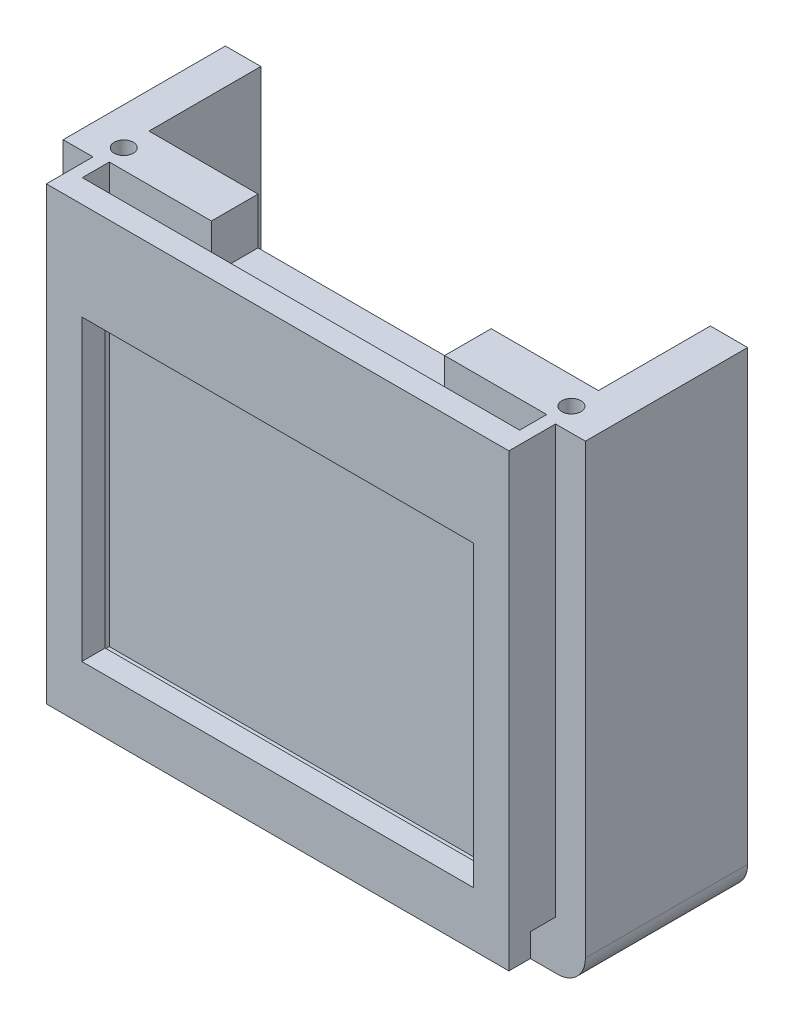
from build123d import *

# Parameters (mm, degrees)
BOSS_EXTRUDE1_OUTLINE_W      = 4.95
BOSS_EXTRUDE1_OUTLINE_H      = 2.9
BOSS_EXTRUDE1_DEPTH          = 51
BOSS_EXTRUDE1_2_OUTLINE_W    = 46.1
BOSS_EXTRUDE1_2_OUTLINE_H    = 2.9
BOSS_EXTRUDE1_2_DEPTH        = 6
SKETCH2_W                    = 56
SKETCH2_H                    = 51
SKETCH2_W_2                  = 42
SKETCH2_H_2                  = 32
BOSS_EXTRUDE2_DEPTH          = 2.5
BOSS_EXTRUDE3_DEPTH          = 5
M3X0_5_TAPPED_HOLE1_D        = 2.5
M3X0_5_TAPPED_HOLE1_DEPTH    = 4
M3X0_5_TAPPED_HOLE1_TIP      = 0.751075774
SKETCH9_W                    = 56
SKETCH9_H                    = 2.5
BOSS_EXTRUDE4_DEPTH          = 5
SKETCH9_3_W                  = 56
SKETCH9_3_H                  = 9.5
BOSS_EXTRUDE5_DEPTH          = 2.5
M2_5X0_45_TAPPED_HOLE1_D     = 2.05
M2_5X0_45_TAPPED_HOLE1_DEPTH = 6.35
M2_5X0_45_TAPPED_HOLE1_TIP   = 0.615882135
BOSS_EXTRUDE6_REACH          = 78.688
SKETCH12_W                   = 4
SKETCH12_H                   = 51
SKETCH13_W                   = 4
SKETCH13_H                   = 9
CUT_EXTRUDE1_DEPTH           = 2.5
SKETCH14_W                   = 12
SKETCH14_H                   = 30
CUT_EXTRUDE2_DEPTH           = 3
CUT_EXTRUDE3_DEPTH           = 78.62731478
SKETCH17_W                   = 5
SKETCH17_H                   = 51
CUT_EXTRUDE4_DEPTH           = 3
SKETCH18_W                   = 5
SKETCH18_H                   = 51
CUT_EXTRUDE5_DEPTH           = 3
FILLET1_R                    = 3
MOVE_FACE1_BY                = 0.2
MOVE_FACE1_2_BY              = 0.2
MOVE_FACE1_3_BY              = 0.2
MOVE_FACE1_4_BY              = 0.2
MOVE_FACE1_5_BY              = 0.2
MOVE_FACE1_6_BY              = 0.2
MOVE_FACE1_7_BY              = 0.2
MOVE_FACE1_8_BY              = 0.2
MOVE_FACE1_9_BY              = 0.2
MOVE_FACE1_10_BY             = 0.2
MOVE_START                   = 4.55
MOVE_FACE2_OUTLINE_W         = 45
MOVE_FACE2_OUTLINE_H         = 2.9
MOVE_FACE2_DEPTH             = 46.9


# Read off the part's stored shape, not the designer's step: Boss-Extrude1, Move Face2
with BuildPart() as part:
    # Boss-Extrude1 outline → Boss-Extrude1 (new body)
    with BuildSketch(Plane(origin=(0, 0, 0), x_dir=(1, 0, 0), z_dir=(0, 1, 0))):
        with Locations((2.475, -1.45)):
            Rectangle(BOSS_EXTRUDE1_OUTLINE_W, BOSS_EXTRUDE1_OUTLINE_H)
        with Locations((53.525, -1.45)):
            Rectangle(BOSS_EXTRUDE1_OUTLINE_W, BOSS_EXTRUDE1_OUTLINE_H)
    extrude(amount=BOSS_EXTRUDE1_DEPTH)

    # Boss-Extrude1 2 outline → Boss-Extrude1 2 (add)
    with BuildSketch(Plane(origin=(0, 0, 0), x_dir=(1, 0, 0), z_dir=(0, 1, 0))):
        with Locations((28, -1.45)):
            Rectangle(BOSS_EXTRUDE1_2_OUTLINE_W, BOSS_EXTRUDE1_2_OUTLINE_H)
    extrude(amount=BOSS_EXTRUDE1_2_DEPTH)

    # Sketch2 → Boss-Extrude2 (add)
    with BuildSketch(Plane.XY.offset(2.9)):
        with Locations((28, 25.5)):
            Rectangle(SKETCH2_W, SKETCH2_H)
        with Locations((28, 24.54)):
            Rectangle(SKETCH2_W_2, SKETCH2_H_2, mode=Mode.SUBTRACT)
    extrude(amount=BOSS_EXTRUDE2_DEPTH)

    # Sketch3 → Boss-Extrude3 (add)
    with BuildSketch(Plane(origin=(0, 0, 0), x_dir=(-1, 0, 0), z_dir=(0, 0, -1))):
        Polygon((-56, 51), (-40.5, 51), (-40.5, 46), (-15.5, 46), (-15.5, 51), (0, 51), (0, 0), (-56, 0), align=None)
    extrude(amount=BOSS_EXTRUDE3_DEPTH)

    # M3x0.5 Tapped Hole1
    with Locations(Plane(origin=(0, 0, -5), x_dir=(-1, 0, 0), z_dir=(0, 0, -1))):
        with Locations((-49.25, 37), (-6.75, 37), (-6.75, 10), (-49.25, 10)):
            Hole(M3X0_5_TAPPED_HOLE1_D / 2, depth=M3X0_5_TAPPED_HOLE1_DEPTH)
            with Locations((0, 0, -(M3X0_5_TAPPED_HOLE1_DEPTH + M3X0_5_TAPPED_HOLE1_TIP / 2))):  # 118° drill point
                Cone(0, M3X0_5_TAPPED_HOLE1_D / 2, M3X0_5_TAPPED_HOLE1_TIP, mode=Mode.SUBTRACT)



with BuildPart() as body_2:
    # Sketch9 → Boss-Extrude4 (new body)
    with BuildSketch(Plane.XZ):
        with Locations((28, -15.75)):
            Rectangle(SKETCH9_W, SKETCH9_H)
    extrude(amount=-BOSS_EXTRUDE4_DEPTH)


with BuildPart() as part_1:
    add(part.part)

    add(body_2.part)  # Boss-Extrude5 merges body 2
    # Sketch9<3> → Boss-Extrude5 (add)
    with BuildSketch(Plane.XZ):
        with Locations((28, -9.75)):
            Rectangle(SKETCH9_3_W, SKETCH9_3_H)
    extrude(amount=-BOSS_EXTRUDE5_DEPTH)

    # M2.5x0.45 Tapped Hole1
    with Locations(Plane(origin=(0, 51, 0), x_dir=(1, 0, 0), z_dir=(0, 1, 0))):
        with Locations((4, 2.1), (52, 2.1)):
            Hole(M2_5X0_45_TAPPED_HOLE1_D / 2, depth=M2_5X0_45_TAPPED_HOLE1_DEPTH)
            with Locations((0, 0, -(M2_5X0_45_TAPPED_HOLE1_DEPTH + M2_5X0_45_TAPPED_HOLE1_TIP / 2))):  # 118° drill point
                Cone(0, M2_5X0_45_TAPPED_HOLE1_D / 2, M2_5X0_45_TAPPED_HOLE1_TIP, mode=Mode.SUBTRACT)

    # Boss-Extrude6: up to this face of the body (flat: up to its plane)
    boss_extrude6_end = Plane(part_1.part.faces().sort_by_distance((28, 2.5, -17))[0])
    # Sketch12 → Boss-Extrude6 (add, up to the picked face)
    with BuildSketch(Plane(origin=(0, 0, -5), x_dir=(-1, 0, 0), z_dir=(0, 0, -1)), mode=Mode.PRIVATE) as boss_extrude6_sk1:
        with Locations((-2, 25.5)):
            Rectangle(SKETCH12_W, SKETCH12_H)
    boss_extrude6_tool1 = split(extrude(boss_extrude6_sk1.sketch, amount=BOSS_EXTRUDE6_REACH, mode=Mode.PRIVATE), bisect_by=boss_extrude6_end, keep=Keep.BOTH, mode=Mode.PRIVATE)
    # Sketch12 → Boss-Extrude6 (add, up to the picked face)
    with BuildSketch(Plane(origin=(0, 0, -5), x_dir=(-1, 0, 0), z_dir=(0, 0, -1)), mode=Mode.PRIVATE) as boss_extrude6_sk2:
        with Locations((-54, 25.5)):
            Rectangle(SKETCH12_W, SKETCH12_H)
    boss_extrude6_tool2 = split(extrude(boss_extrude6_sk2.sketch, amount=BOSS_EXTRUDE6_REACH, mode=Mode.PRIVATE), bisect_by=boss_extrude6_end, keep=Keep.BOTH, mode=Mode.PRIVATE)
    add(boss_extrude6_tool1.solids().sort_by(Axis((2, 25.5, -5), (0, 0, -1)))[0])
    add(boss_extrude6_tool2.solids().sort_by(Axis((54, 25.5, -5), (0, 0, -1)))[0])

    # Sketch13 → Cut-Extrude1 (cut)
    with BuildSketch(Plane(origin=(0, 0, -5), x_dir=(-1, 0, 0), z_dir=(0, 0, -1))):
        with Locations((-45, 30)):
            Rectangle(SKETCH13_W, SKETCH13_H)
    extrude(amount=-CUT_EXTRUDE1_DEPTH, mode=Mode.SUBTRACT)

    # Sketch14 → Cut-Extrude2 (cut)
    with BuildSketch(Plane.ZY.offset(-52)):
        with Locations((-11, 31)):
            Rectangle(SKETCH14_W, SKETCH14_H)
    extrude(amount=-CUT_EXTRUDE2_DEPTH, mode=Mode.SUBTRACT)

    # Sketch15 → Cut-Extrude3 (cut, through all)
    with BuildSketch(Plane.ZY):
        Polygon((5.4, 0), (0.4, 0), (0.4, 5), (2.9, 5), (2.9, 2.5), (5.4, 2.5), align=None)
    extrude(amount=-CUT_EXTRUDE3_DEPTH, mode=Mode.SUBTRACT)

    # Sketch17 → Cut-Extrude4 (cut)
    with BuildSketch(Plane.ZY):
        with Locations((2.9, 25.5)):
            Rectangle(SKETCH17_W, SKETCH17_H)
    extrude(amount=-CUT_EXTRUDE4_DEPTH, mode=Mode.SUBTRACT)

    # Sketch18 → Cut-Extrude5 (cut)
    with BuildSketch(Plane(origin=(56, 0, 0), x_dir=(0, 0, -1), z_dir=(1, 0, 0))):
        with Locations((-2.9, 25.5)):
            Rectangle(SKETCH18_W, SKETCH18_H)
    extrude(amount=-CUT_EXTRUDE5_DEPTH, mode=Mode.SUBTRACT)

    # Fillet1
    fillet1_edges = [part_1.edges().sort_by_distance(p)[0] for p in [
        (56, 0, -8.3),
        (0, 0, -8.3),
    ]]
    fillet(fillet1_edges, radius=FILLET1_R)

    # Move Face1: a face moved inward by 0.2
    extrude(part_1.faces().sort_by_distance((28, 3.75, 2.9))[0], amount=MOVE_FACE1_BY, dir=(0, 0, 1), mode=Mode.SUBTRACT)

    # Move Face1 2: a face moved inward by 0.2
    extrude(part_1.faces().sort_by_distance((28, 2.5, 4.15))[0], amount=MOVE_FACE1_2_BY, dir=(0, 1, 0), mode=Mode.SUBTRACT)

    # Move Face1 3: a face moved inward by 0.2
    extrude(part_1.faces().sort_by_distance((28, 5, 1.65))[0], amount=MOVE_FACE1_3_BY, dir=(0, 1, 0), mode=Mode.SUBTRACT)

    # Move Face1 4: a face moved inward by 0.2
    extrude(part_1.faces().sort_by_distance((3, 27.358465608, 2.933068783))[0], amount=MOVE_FACE1_4_BY, dir=(1, 0, 0), mode=Mode.SUBTRACT)

    # Move Face1 5: a face moved inward by 0.2
    extrude(part_1.faces().sort_by_distance((53, 27.358465608, 2.933068783))[0], amount=MOVE_FACE1_5_BY, dir=(-1, 0, 0), mode=Mode.SUBTRACT)

    # Move Face1 6: a face moved inward by 0.2
    extrude(part_1.faces().sort_by_distance((28, 2.5, -9.75))[0], amount=MOVE_FACE1_6_BY, dir=(0, -1, 0), mode=Mode.SUBTRACT)

    # Move Face1 7: a face moved inward by 0.2
    extrude(part_1.faces().sort_by_distance((28, 3.75, -14.5))[0], amount=MOVE_FACE1_7_BY, dir=(0, 0, -1), mode=Mode.SUBTRACT)

    # Move Face1 8: a face moved inward by 0.2
    extrude(part_1.faces().sort_by_distance((28, 5, -15.75))[0], amount=MOVE_FACE1_8_BY, dir=(0, -1, 0), mode=Mode.SUBTRACT)

    # Move Face1 9: a face moved inward by 0.2
    extrude(part_1.faces().sort_by_distance((4, 26.999674338, -10.948436822))[0], amount=MOVE_FACE1_9_BY, dir=(-1, 0, 0), mode=Mode.SUBTRACT)

    # Move Face1 10: a face moved inward by 0.2
    extrude(part_1.faces().sort_by_distance((52, 9.47070626, -10.809390048))[0], amount=MOVE_FACE1_10_BY, dir=(1, 0, 0), mode=Mode.SUBTRACT)

    # Move Face2 outline → Move Face2 (cut)
    with BuildSketch(Plane.YZ.offset(MOVE_START)):
        with Locations((28.5, 1.45)):
            Rectangle(MOVE_FACE2_OUTLINE_W, MOVE_FACE2_OUTLINE_H)
    extrude(amount=MOVE_FACE2_DEPTH, mode=Mode.SUBTRACT)


solid = part_1.part
